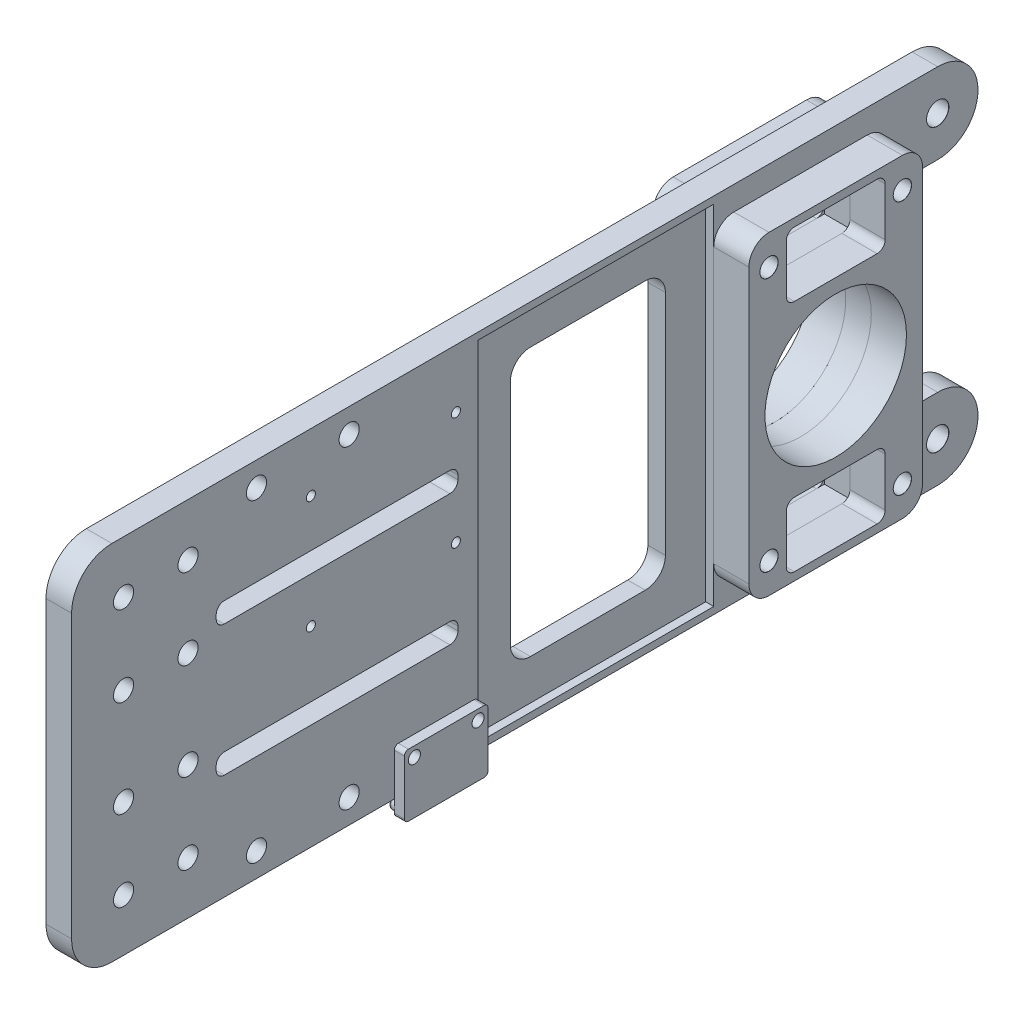
from build123d import *

# Parameters (mm, degrees)
SKETCH1_W                            = 90
SKETCH1_H                            = 225
SKETCH1_R                            = 17.5641
BOSS_EXTRUDE1_DEPTH                  = 3.175
SKETCH2_W                            = 78.1
SKETCH2_H                            = 43.1
BOSS_EXTRUDE2_DEPTH                  = 8.73125
M4_CLEARANCE_HOLE2_AT_2_COUNT        = 2
M4_CLEARANCE_HOLE2_AT_2_PITCH        = 33.1
M4_CLEARANCE_HOLE2_AT_3_COUNT        = 2
M4_CLEARANCE_HOLE2_AT_3_PITCH        = 71.254613886
M4_CLEARANCE_HOLE2_AT_4_COUNT        = 2
M4_CLEARANCE_HOLE2_AT_4_PITCH        = 63.1
SKETCH24_W                           = 78.1
SKETCH24_H                           = 43.1
BOSS_EXTRUDE3_DEPTH                  = 8.73125
TAP_DRILL_FOR_M4X0_7_TAP1_AT_2_COUNT = 2
TAP_DRILL_FOR_M4X0_7_TAP1_AT_2_PITCH = 33.1
TAP_DRILL_FOR_M4X0_7_TAP1_AT_3_COUNT = 2
TAP_DRILL_FOR_M4X0_7_TAP1_AT_3_PITCH = 71.254613886
TAP_DRILL_FOR_M4X0_7_TAP1_AT_4_COUNT = 2
TAP_DRILL_FOR_M4X0_7_TAP1_AT_4_PITCH = 63.1
TAP_DRILL_FOR_M3X0_5_TAP1_AT_2_COUNT = 2
TAP_DRILL_FOR_M3X0_5_TAP1_AT_2_PITCH = 15.8
SKETCH3_R                            = 17.5641
CUT_EXTRUDE3_DEPTH                   = 188.975896477
M5_CLEARANCE_HOLE1_AT_2_COUNT        = 2
M5_CLEARANCE_HOLE1_AT_2_PITCH        = 70
SKETCH14_W                           = 86.5
SKETCH14_H                           = 58.5
CUT_EXTRUDE4_DEPTH                   = 2
FILLET4_R                            = 10
FILLET5_R                            = 5
FILLET6_R                            = 5
SKETCH28_W                           = 15.5
SKETCH28_H                           = 20.75
SKETCH28_R                           = 1.5
BOSS_EXTRUDE4_DEPTH                  = 2.5
FILLET7_R                            = 1
SKETCH29_R                           = 1.5
BOSS_EXTRUDE5_DEPTH                  = 1.5
FILLET8_R                            = 0.5
SKETCH34_W                           = 1.1303
SKETCH34_H                           = 15.08125
TAP_DRILL_FOR_4_40_TAP1_AT_2_COUNT   = 2
TAP_DRILL_FOR_4_40_TAP1_AT_2_PITCH   = 36
TAP_DRILL_FOR_4_40_TAP1_AT_3_COUNT   = 2
TAP_DRILL_FOR_4_40_TAP1_AT_3_PITCH   = 45.607017004
TAP_DRILL_FOR_4_40_TAP1_AT_4_COUNT   = 2
TAP_DRILL_FOR_4_40_TAP1_AT_4_PITCH   = 28
SKETCH36_W                           = 16
SKETCH36_H                           = 24.55
CUT_EXTRUDE6_DEPTH                   = 189.979862105
FILLET9_R                            = 2
FILLET10_R                           = 2
CUT_EXTRUDE7_DEPTH                   = 189.079231247
CUT_EXTRUDE7_DEPTH_BACK              = 189.079231247
CUT_EXTRUDE8_DEPTH                   = 189.079231247
SKETCH39_R                           = 2.5
CUT_EXTRUDE9_DEPTH                   = 189.079231247


with BuildPart() as part:
    # Sketch1 → Boss-Extrude1 (new, symmetric)
    with BuildSketch(Plane.YZ):
        with Locations((0, 68.45)):
            Rectangle(SKETCH1_W, SKETCH1_H)
        Circle(SKETCH1_R, mode=Mode.SUBTRACT)
    extrude(amount=BOSS_EXTRUDE1_DEPTH, both=True)


with BuildPart() as body_2:
    # Sketch2 → Boss-Extrude2 (new body)
    with BuildSketch(Plane.YZ.offset(3.175)):
        Rectangle(SKETCH2_W, SKETCH2_H)
    extrude(amount=BOSS_EXTRUDE2_DEPTH)


with BuildPart() as m4_clearance_hole2_tool:
    # Sketch23 → M4 Clearance Hole2 (revolve)
    with BuildSketch(Plane(origin=(11.90625, -31.55, 16.55), x_dir=(0, 0, -1), z_dir=(0, 1, 0))):
        Polygon((0, 0), (0, 15.08125), (2.25, 15.08125), (2.25, 0.025), (2.275, 0), align=None)
    m4_clearance_hole2 = revolve(axis=Axis((18.25625, -31.55, 16.55), (-1, 0, 0)))


with BuildPart() as part_1:
    add(part.part)

    # M4 Clearance Hole2: cut by m4_clearance_hole2_tool
    add(m4_clearance_hole2_tool.part, mode=Mode.SUBTRACT)


with BuildPart() as body_2_1:
    add(body_2.part)

    # M4 Clearance Hole2: cut by m4_clearance_hole2_tool
    add(m4_clearance_hole2_tool.part, mode=Mode.SUBTRACT)


with BuildPart() as m4_clearance_hole2_at_2_tool:
    # M4 Clearance Hole2 at 2: M4 Clearance Hole2 ×2
    with Locations(*[(0, 0, -i * M4_CLEARANCE_HOLE2_AT_2_PITCH) for i in range(1, M4_CLEARANCE_HOLE2_AT_2_COUNT)]):
        add(m4_clearance_hole2)


with BuildPart() as part_2:
    add(part_1.part)

    # M4 Clearance Hole2 at 2: cut by m4_clearance_hole2_at_2_tool
    add(m4_clearance_hole2_at_2_tool.part, mode=Mode.SUBTRACT)


with BuildPart() as body_2_2:
    add(body_2_1.part)

    # M4 Clearance Hole2 at 2: cut by m4_clearance_hole2_at_2_tool
    add(m4_clearance_hole2_at_2_tool.part, mode=Mode.SUBTRACT)


with BuildPart() as m4_clearance_hole2_at_3_tool:
    # M4 Clearance Hole2 at 3: M4 Clearance Hole2 ×2
    with Locations(*[Vector(0, 0.8855566897214588, -0.4645313221835228) * (i * M4_CLEARANCE_HOLE2_AT_3_PITCH) for i in range(1, M4_CLEARANCE_HOLE2_AT_3_COUNT)]):
        add(m4_clearance_hole2)


with BuildPart() as part_3:
    add(part_2.part)

    # M4 Clearance Hole2 at 3: cut by m4_clearance_hole2_at_3_tool
    add(m4_clearance_hole2_at_3_tool.part, mode=Mode.SUBTRACT)


with BuildPart() as body_2_3:
    add(body_2_2.part)

    # M4 Clearance Hole2 at 3: cut by m4_clearance_hole2_at_3_tool
    add(m4_clearance_hole2_at_3_tool.part, mode=Mode.SUBTRACT)


with BuildPart() as m4_clearance_hole2_at_4_tool:
    # M4 Clearance Hole2 at 4: M4 Clearance Hole2 ×2
    with Locations(*[(0, i * M4_CLEARANCE_HOLE2_AT_4_PITCH, 0) for i in range(1, M4_CLEARANCE_HOLE2_AT_4_COUNT)]):
        add(m4_clearance_hole2)


with BuildPart() as part_4:
    add(part_3.part)

    # M4 Clearance Hole2 at 4: cut by m4_clearance_hole2_at_4_tool
    add(m4_clearance_hole2_at_4_tool.part, mode=Mode.SUBTRACT)

    # Sketch10 → Tap Drill for M3x0.5 Tap1 (revolve, cut)
    with BuildSketch(Plane(origin=(3.175, -36, 98.35), x_dir=(0, 0, -1), z_dir=(0, 1, 0))):
        Polygon((0, 0), (0, 15.08125), (1.25, 15.08125), (1.25, 0.025), (1.275, 0), align=None)
    tap_drill_for_m3x0_5_tap1 = revolve(axis=Axis((9.525, -36, 98.35), (-1, 0, 0)), mode=Mode.SUBTRACT)

    # Tap Drill for M3x0.5 Tap1 at 2: Tap Drill for M3x0.5 Tap1 ×2
    with Locations(*[(0, 0, -i * TAP_DRILL_FOR_M3X0_5_TAP1_AT_2_PITCH) for i in range(1, TAP_DRILL_FOR_M3X0_5_TAP1_AT_2_COUNT)]):
        add(tap_drill_for_m3x0_5_tap1, mode=Mode.SUBTRACT)

    # Sketch12 → M5 Clearance Hole1 (revolve, cut)
    with BuildSketch(Plane(origin=(3.175, -35, -34.05), x_dir=(0, 0, -1), z_dir=(0, 1, 0))):
        Polygon((0, 0), (0, 15.08125), (2.75, 15.08125), (2.75, 0.025), (2.775, 0), align=None)
    m5_clearance_hole1 = revolve(axis=Axis((9.525, -35, -34.05), (-1, 0, 0)), mode=Mode.SUBTRACT)

    # M5 Clearance Hole1 at 2: M5 Clearance Hole1 ×2
    with Locations(*[(0, i * M5_CLEARANCE_HOLE1_AT_2_PITCH, 0) for i in range(1, M5_CLEARANCE_HOLE1_AT_2_COUNT)]):
        add(m5_clearance_hole1, mode=Mode.SUBTRACT)

    # Sketch14 → Cut-Extrude4 (cut)
    with BuildSketch(Plane.YZ.offset(3.175)):
        with Locations((0, 50.8)):
            Rectangle(SKETCH14_W, SKETCH14_H)
    extrude(amount=-CUT_EXTRUDE4_DEPTH, mode=Mode.SUBTRACT)

    # Fillet4
    fillet4_edges = [part_4.edges().sort_by_distance(p)[0] for p in [
        (0, 45, -44.05),
        (0, -45, -44.05),
        (0, 45, 180.95),
        (0, -45, 180.95),
    ]]
    fillet(fillet4_edges, radius=FILLET4_R)

    # Sketch34 → Tap Drill for #4-40 Tap1 (revolve, cut)
    with BuildSketch(Plane(origin=(3.175, 2.5, 121.55), x_dir=(0, 0, -1), z_dir=(0, 1, 0))):
        with Locations((0.56515, 7.540625)):
            Rectangle(SKETCH34_W, SKETCH34_H)
    tap_drill_for_4_40_tap1 = revolve(axis=Axis((9.525, 2.5, 121.55), (-1, 0, 0)), mode=Mode.SUBTRACT)

    # Tap Drill for #4-40 Tap1 at 2: Tap Drill for #4-40 Tap1 ×2
    with Locations(*[(0, 0, -i * TAP_DRILL_FOR_4_40_TAP1_AT_2_PITCH) for i in range(1, TAP_DRILL_FOR_4_40_TAP1_AT_2_COUNT)]):
        add(tap_drill_for_4_40_tap1, mode=Mode.SUBTRACT)

    # Tap Drill for #4-40 Tap1 at 3: Tap Drill for #4-40 Tap1 ×2
    with Locations(*[Vector(0, 0.6139406135149202, -0.7893522173763264) * (i * TAP_DRILL_FOR_4_40_TAP1_AT_3_PITCH) for i in range(1, TAP_DRILL_FOR_4_40_TAP1_AT_3_COUNT)]):
        add(tap_drill_for_4_40_tap1, mode=Mode.SUBTRACT)

    # Tap Drill for #4-40 Tap1 at 4: Tap Drill for #4-40 Tap1 ×2
    with Locations(*[(0, i * TAP_DRILL_FOR_4_40_TAP1_AT_4_PITCH, 0) for i in range(1, TAP_DRILL_FOR_4_40_TAP1_AT_4_COUNT)]):
        add(tap_drill_for_4_40_tap1, mode=Mode.SUBTRACT)


with BuildPart() as body_2_4:
    add(body_2_3.part)

    # M4 Clearance Hole2 at 4: cut by m4_clearance_hole2_at_4_tool
    add(m4_clearance_hole2_at_4_tool.part, mode=Mode.SUBTRACT)


with BuildPart() as body_3:
    # Sketch24 → Boss-Extrude3 (new body)
    with BuildSketch(Plane(origin=(-3.175, 0, 0), x_dir=(0, -1, 0), z_dir=(-1, 0, 0))):
        Rectangle(SKETCH24_W, SKETCH24_H)
    extrude(amount=BOSS_EXTRUDE3_DEPTH)

    # Sketch27 → Tap Drill for M4x0.7 Tap1 (revolve, cut)
    with BuildSketch(Plane(origin=(-11.90625, 31.55, 16.55), x_dir=(0, 0, 1), z_dir=(0, 1, 0))):
        Polygon((0, 0), (0, 9.722670021), (1.65, 8.73125), (1.65, 0.025), (1.675, 0), align=None)
    tap_drill_for_m4x0_7_tap1 = revolve(axis=Axis((-18.25625, 31.55, 16.55), (1, 0, 0)), mode=Mode.SUBTRACT)

    # Tap Drill for M4x0.7 Tap1 at 2: Tap Drill for M4x0.7 Tap1 ×2
    with Locations(*[(0, 0, -i * TAP_DRILL_FOR_M4X0_7_TAP1_AT_2_PITCH) for i in range(1, TAP_DRILL_FOR_M4X0_7_TAP1_AT_2_COUNT)]):
        add(tap_drill_for_m4x0_7_tap1, mode=Mode.SUBTRACT)

    # Tap Drill for M4x0.7 Tap1 at 3: Tap Drill for M4x0.7 Tap1 ×2
    with Locations(*[Vector(0, -0.8855566897214588, -0.4645313221835228) * (i * TAP_DRILL_FOR_M4X0_7_TAP1_AT_3_PITCH) for i in range(1, TAP_DRILL_FOR_M4X0_7_TAP1_AT_3_COUNT)]):
        add(tap_drill_for_m4x0_7_tap1, mode=Mode.SUBTRACT)

    # Tap Drill for M4x0.7 Tap1 at 4: Tap Drill for M4x0.7 Tap1 ×2
    with Locations(*[(0, -i * TAP_DRILL_FOR_M4X0_7_TAP1_AT_4_PITCH, 0) for i in range(1, TAP_DRILL_FOR_M4X0_7_TAP1_AT_4_COUNT)]):
        add(tap_drill_for_m4x0_7_tap1, mode=Mode.SUBTRACT)


with BuildPart() as cut_extrude3_tool:
    # Sketch3 → Cut-Extrude3 (new, through all)
    with BuildSketch(Plane.YZ.offset(11.90625)):
        Circle(SKETCH3_R)
    extrude(amount=-CUT_EXTRUDE3_DEPTH)


with BuildPart() as body_2_5:
    add(body_2_4.part)

    # Cut-Extrude3: cut by cut_extrude3_tool
    add(cut_extrude3_tool.part, mode=Mode.SUBTRACT)

    # Fillet6
    fillet6_edges = [body_2_5.edges().sort_by_distance(p)[0] for p in [
        (7.540625, -39.05, 21.55),
        (7.540625, 39.05, -21.55),
        (7.540625, -39.05, -21.55),
        (7.540625, 39.05, 21.55),
    ]]
    fillet(fillet6_edges, radius=FILLET6_R)


with BuildPart() as body_3_1:
    add(body_3.part)

    # Cut-Extrude3: cut by cut_extrude3_tool
    add(cut_extrude3_tool.part, mode=Mode.SUBTRACT)

    # Fillet5
    fillet5_edges = [body_3_1.edges().sort_by_distance(p)[0] for p in [
        (-7.540625, -39.05, 21.55),
        (-7.540625, -39.05, -21.55),
        (-7.540625, 39.05, -21.55),
        (-7.540625, 39.05, 21.55),
    ]]
    fillet(fillet5_edges, radius=FILLET5_R)


with BuildPart() as body_4:
    # Sketch28 → Boss-Extrude4 (new body)
    with BuildSketch(Plane.YZ.offset(3.175)):
        with Locations((-41.275, 90.45)):
            Rectangle(SKETCH28_W, SKETCH28_H)
        with Locations((-36, 82.55)):
            Circle(SKETCH28_R, mode=Mode.SUBTRACT)
        with Locations((-36, 98.35)):
            Circle(SKETCH28_R, mode=Mode.SUBTRACT)
    extrude(amount=BOSS_EXTRUDE4_DEPTH)

    # Fillet7
    fillet7_edges = [body_4.edges().sort_by_distance(p)[0] for p in [
        (4.425, -33.525, 100.825),
        (4.425, -33.525, 80.075),
        (4.425, -49.025, 80.075),
        (4.425, -49.025, 100.825),
    ]]
    fillet(fillet7_edges, radius=FILLET7_R)

    # Sketch29 → Boss-Extrude5 (add)
    with BuildSketch(Plane(origin=(3.175, 0, 0), x_dir=(0, -1, 0), z_dir=(-1, 0, 0))):
        with Locations((47.025, 99.2)):
            Circle(SKETCH29_R)
        with Locations((47.025, 95.7)):
            Circle(SKETCH29_R)
        with Locations((47.025, 92.2)):
            Circle(SKETCH29_R)
        with Locations((47.025, 88.7)):
            Circle(SKETCH29_R)
        with Locations((47.025, 85.2)):
            Circle(SKETCH29_R)
        with Locations((47.025, 81.7)):
            Circle(SKETCH29_R)
    extrude(amount=BOSS_EXTRUDE5_DEPTH)

    # Fillet8
    fillet8_edges = [body_4.edges().sort_by_distance(p)[0] for p in [
        (1.675, -45.525, 81.7),
        (1.675, -45.525, 85.2),
        (1.675, -45.525, 88.7),
        (1.675, -45.525, 92.2),
        (1.675, -45.525, 95.7),
        (1.675, -45.525, 99.2),
    ]]
    fillet(fillet8_edges, radius=FILLET8_R)


with BuildPart() as cut_extrude6_tool:
    # Sketch36 → Cut-Extrude6 (new, through all)
    with BuildSketch(Plane.YZ.offset(11.90625)):
        with Locations((-29.05, 0)):
            Rectangle(SKETCH36_W, SKETCH36_H)
        with Locations((29.05, 0)):
            Rectangle(SKETCH36_W, SKETCH36_H)
    extrude(amount=-CUT_EXTRUDE6_DEPTH)


with BuildPart() as part_5:
    add(part_4.part)

    # Cut-Extrude6: cut by cut_extrude6_tool
    add(cut_extrude6_tool.part, mode=Mode.SUBTRACT)

    # Sketch37 → Cut-Extrude7 (cut, two sides: drawn at the far end of the back side and taken through both)
    with BuildSketch(Plane.YZ.offset(3.175).offset(-CUT_EXTRUDE7_DEPTH_BACK)):
        with BuildLine():
            Line((-16.75, 145.05), (-15.75, 145.05))
            ThreePointArc((-15.75, 145.05), (-14.335786438, 144.464213562), (-13.75, 143.05))
            Line((-13.75, 143.05), (-13.75, 87.05))
            ThreePointArc((-13.75, 87.05), (-14.335786438, 85.635786438), (-15.75, 85.05))
            Line((-15.75, 85.05), (-16.75, 85.05))
            ThreePointArc((-16.75, 85.05), (-18.164213562, 85.635786438), (-18.75, 87.05))
            Line((-18.75, 87.05), (-18.75, 143.05))
            ThreePointArc((-18.75, 143.05), (-18.164213562, 144.464213562), (-16.75, 145.05))
        make_face()
        with BuildLine():
            Line((13.75, 143.05), (13.75, 87.05))
            ThreePointArc((13.75, 87.05), (14.335786438, 85.635786438), (15.75, 85.05))
            Line((15.75, 85.05), (16.75, 85.05))
            ThreePointArc((16.75, 85.05), (18.164213562, 85.635786438), (18.75, 87.05))
            Line((18.75, 87.05), (18.75, 143.05))
            ThreePointArc((18.75, 143.05), (18.164213562, 144.464213562), (16.75, 145.05))
            Line((16.75, 145.05), (15.75, 145.05))
            ThreePointArc((15.75, 145.05), (14.335786438, 144.464213562), (13.75, 143.05))
        make_face()
    extrude(amount=CUT_EXTRUDE7_DEPTH + CUT_EXTRUDE7_DEPTH_BACK, mode=Mode.SUBTRACT)

    # Sketch38 → Cut-Extrude8 (cut, through all)
    with BuildSketch(Plane.YZ.offset(3.175)):
        with BuildLine():
            ThreePointArc((-33.25, 36.55), (-31.785533906, 33.014466094), (-28.25, 31.55))
            Line((-28.25, 31.55), (28.25, 31.55))
            ThreePointArc((28.25, 31.55), (31.785533906, 33.014466094), (33.25, 36.55))
            Line((33.25, 36.55), (33.25, 65.05))
            ThreePointArc((33.25, 65.05), (31.785533906, 68.585533906), (28.25, 70.05))
            Line((28.25, 70.05), (-28.25, 70.05))
            ThreePointArc((-28.25, 70.05), (-31.785533906, 68.585533906), (-33.25, 65.05))
            Line((-33.25, 65.05), (-33.25, 36.55))
        make_face()
        with BuildLine():
            ThreePointArc((-20, -24.05), (-23.535533906, -25.514466094), (-25, -29.05))
            Line((-25, -29.05), (-25, -34.05))
            ThreePointArc((-25, -34.05), (-27.928932188, -41.121067812), (-35, -44.05))
            Line((-35, -44.05), (35, -44.05))
            ThreePointArc((35, -44.05), (27.928932188, -41.121067812), (25, -34.05))
            Line((25, -34.05), (25, -29.05))
            ThreePointArc((25, -29.05), (23.535533906, -25.514466094), (20, -24.05))
            Line((20, -24.05), (-20, -24.05))
        make_face()
    extrude(amount=-CUT_EXTRUDE8_DEPTH, mode=Mode.SUBTRACT)

    # Sketch39 → Cut-Extrude9 (cut, through all)
    with BuildSketch(Plane.YZ.offset(3.175)):
        with Locations((39, 112.05)):
            Circle(SKETCH39_R)
        with Locations((32, 168.05)):
            Circle(SKETCH39_R)
        with Locations((32, 152.05)):
            Circle(SKETCH39_R)
        with Locations((12, 168.05)):
            Circle(SKETCH39_R)
        with Locations((12, 152.05)):
            Circle(SKETCH39_R)
        with Locations((39, 135.05)):
            Circle(SKETCH39_R)
        with Locations((-39, 135.05)):
            Circle(SKETCH39_R)
        with Locations((-12, 152.05)):
            Circle(SKETCH39_R)
        with Locations((-12, 168.05)):
            Circle(SKETCH39_R)
        with Locations((-32, 152.05)):
            Circle(SKETCH39_R)
        with Locations((-32, 168.05)):
            Circle(SKETCH39_R)
        with Locations((-39, 112.05)):
            Circle(SKETCH39_R)
    extrude(amount=-CUT_EXTRUDE9_DEPTH, mode=Mode.SUBTRACT)


with BuildPart() as body_2_6:
    add(body_2_5.part)

    # Cut-Extrude6: cut by cut_extrude6_tool
    add(cut_extrude6_tool.part, mode=Mode.SUBTRACT)

    # Fillet9
    fillet9_edges = [body_2_6.edges().sort_by_distance(p)[0] for p in [
        (7.540625, -37.05, 12.275),
        (7.540625, 21.05, -12.275),
        (7.540625, 37.05, -12.275),
        (7.540625, 37.05, 12.275),
        (7.540625, 21.05, 12.275),
        (7.540625, -21.05, -12.275),
        (7.540625, -37.05, -12.275),
        (7.540625, -21.05, 12.275),
    ]]
    fillet(fillet9_edges, radius=FILLET9_R)


with BuildPart() as body_3_2:
    add(body_3_1.part)

    # Cut-Extrude6: cut by cut_extrude6_tool
    add(cut_extrude6_tool.part, mode=Mode.SUBTRACT)

    # Fillet10
    fillet10_edges = [body_3_2.edges().sort_by_distance(p)[0] for p in [
        (-7.540625, -21.05, 12.275),
        (-7.540625, -21.05, -12.275),
        (-7.540625, -37.05, -12.275),
        (-7.540625, -37.05, 12.275),
        (-7.540625, 37.05, -12.275),
        (-7.540625, 21.05, -12.275),
        (-7.540625, 21.05, 12.275),
        (-7.540625, 37.05, 12.275),
    ]]
    fillet(fillet10_edges, radius=FILLET10_R)


solid = Compound([body_4.part, part_5.part, body_2_6.part, body_3_2.part])
